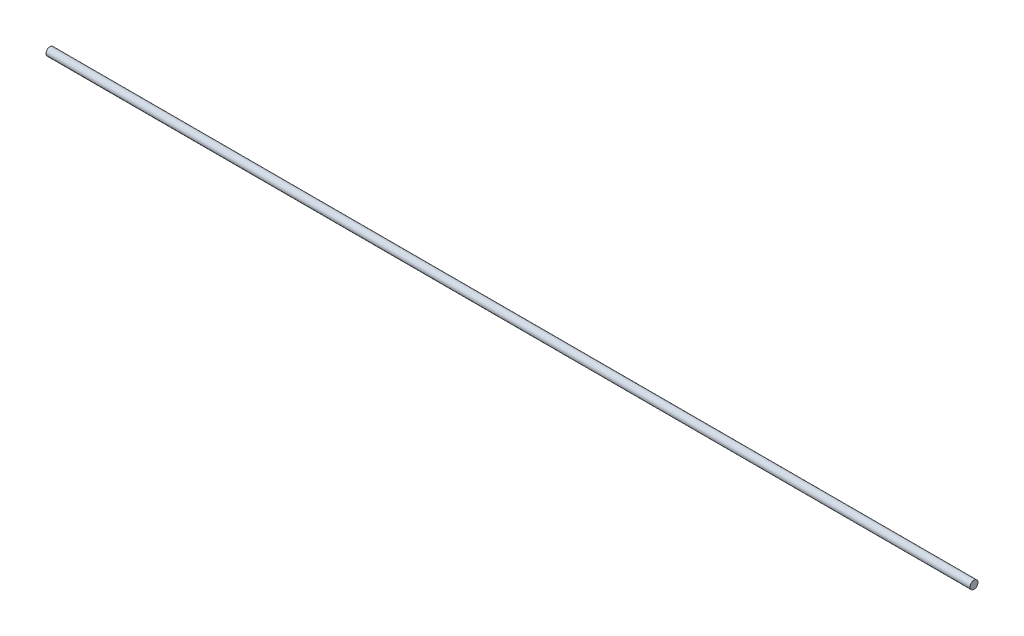
from build123d import *

# Parameters (mm, degrees)
SKETCH1_R           = 3.175
BOSS_EXTRUDE1_DEPTH = 736.6


with BuildPart() as part:
    # Sketch1 → Boss-Extrude1 (new body)
    with BuildSketch(Plane(origin=(0, 0, 0), x_dir=(0, 0, -1), z_dir=(1, 0, 0))):
        Circle(SKETCH1_R)
    extrude(amount=BOSS_EXTRUDE1_DEPTH)


solid = part.part
